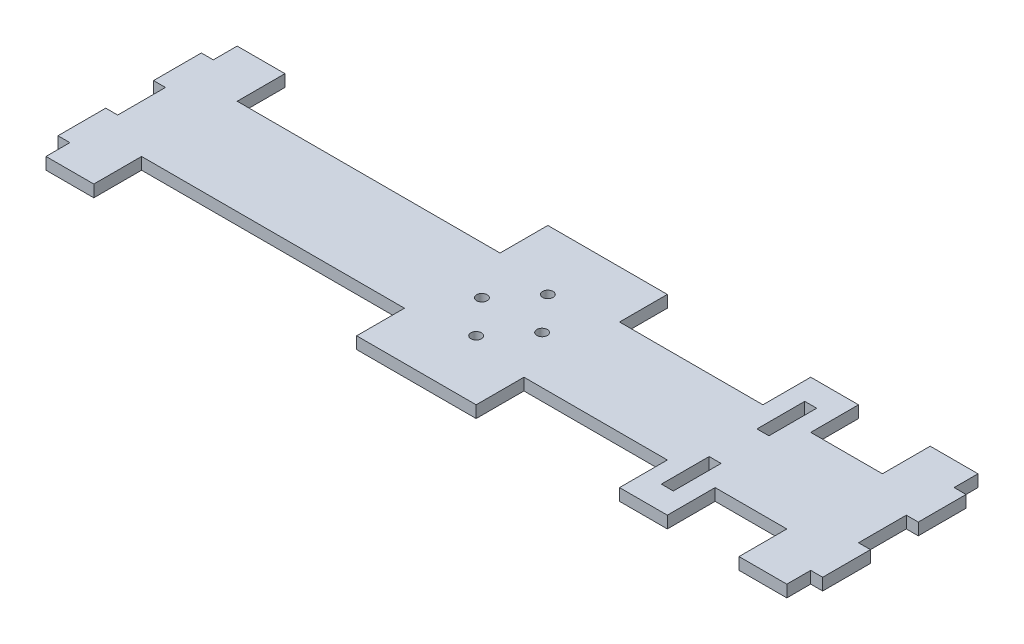
from build123d import *

# Parameters (mm, degrees)
SKETCH1_R           = 1.397
SKETCH1_W           = 3.175
SKETCH1_H           = 12.7
BOSS_EXTRUDE1_DEPTH = 3.175


with BuildPart() as part:
    # Sketch1 → Boss-Extrude1 (new body)
    with BuildSketch(Plane(origin=(0, 0, 0), x_dir=(1, 0, 0), z_dir=(0, 1, 0))):
        Polygon((82.55, 31.75), (82.55, 44.45), (114.3, 44.45), (114.3, 31.75), (152.4, 31.75), (152.4, 44.45), (165.1, 44.45), (165.1, 31.75), (184.15, 31.75), (184.15, 44.45), (196.85, 44.45), (196.85, 38.1), (200.025, 38.1), (200.025, 25.4), (196.85, 25.4), (196.85, 12.7), (200.025, 12.7), (200.025, 0), (196.85, 0), (196.85, -6.35), (184.15, -6.35), (184.15, 6.35), (165.1, 6.35), (165.1, -6.35), (152.4, -6.35), (152.4, 6.35), (114.3, 6.35), (114.3, -6.35), (82.55, -6.35), (82.55, 6.35), (12.7, 6.35), (12.7, -6.35), (0, -6.35), (0, 0), (-3.175, 0), (-3.175, 12.7), (0, 12.7), (0, 25.4), (-3.175, 25.4), (-3.175, 38.1), (0, 38.1), (0, 44.45), (12.7, 44.45), (12.7, 31.75), align=None)
        with Locations((90.424, 19.05)):
            Circle(SKETCH1_R, mode=Mode.SUBTRACT)
        with Locations((106.426, 19.05)):
            Circle(SKETCH1_R, mode=Mode.SUBTRACT)
        with Locations((98.425, 28.575)):
            Circle(SKETCH1_R, mode=Mode.SUBTRACT)
        with Locations((98.425, 9.525)):
            Circle(SKETCH1_R, mode=Mode.SUBTRACT)
        with Locations((158.75, 6.35)):
            Rectangle(SKETCH1_W, SKETCH1_H, mode=Mode.SUBTRACT)
        with Locations((158.75, 31.75)):
            Rectangle(SKETCH1_W, SKETCH1_H, mode=Mode.SUBTRACT)
    extrude(amount=BOSS_EXTRUDE1_DEPTH)


solid = part.part
